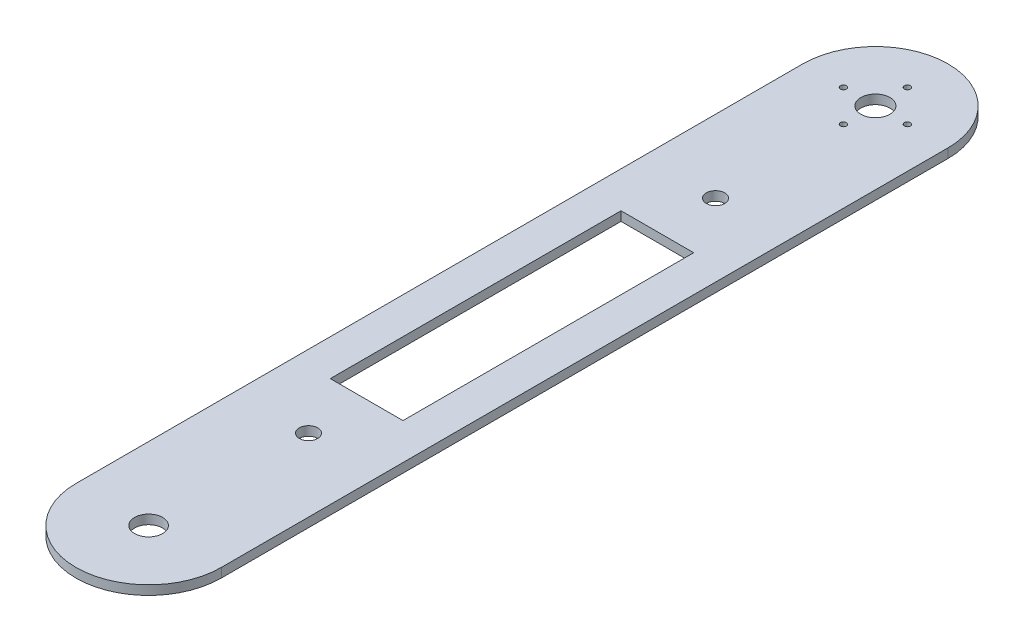
from build123d import *

# Parameters (mm, degrees)
SKETCH1_W           = 50
SKETCH1_H           = 300
BOSS_EXTRUDE1_DEPTH = 3.175
CUT_EXTRUDE1_DEPTH  = 6.35
SKETCH3_R           = 5
SKETCH3_R_2         = 4.82
SKETCH3_R_3         = 1.025
CUT_EXTRUDE2_DEPTH  = 6.35
SKETCH4_R           = 3.175
SKETCH4_W           = 25
SKETCH4_H           = 100
CUT_EXTRUDE3_DEPTH  = 6.35


with BuildPart() as part:
    # Sketch1 → Boss-Extrude1 (new body)
    with BuildSketch(Plane(origin=(0, 0, 0), x_dir=(1, 0, 0), z_dir=(0, 1, 0))):
        with Locations((25, -150)):
            Rectangle(SKETCH1_W, SKETCH1_H)
    extrude(amount=BOSS_EXTRUDE1_DEPTH)

    # Sketch2 → Cut-Extrude1 (cut)
    with BuildSketch(Plane(origin=(0, 3.175, 0), x_dir=(1, 0, 0), z_dir=(0, 1, 0))):
        with BuildLine():
            Line((0, 0), (0, -25))
            ThreePointArc((0, -25), (7.32233047, -7.32233047), (25, 0))
            Line((25, 0), (0, 0))
        make_face()
        with BuildLine():
            ThreePointArc((25, 0), (42.67766953, -7.32233047), (50, -25))
            Line((50, -25), (50, 0))
            Line((50, 0), (25, 0))
        make_face()
        with BuildLine():
            ThreePointArc((25, -300), (7.32233047, -292.67766953), (0, -275))
            Line((0, -275), (0, -300))
            Line((0, -300), (25, -300))
        make_face()
        with BuildLine():
            Line((50, -300), (50, -275))
            ThreePointArc((50, -275), (42.67766953, -292.67766953), (25, -300))
            Line((25, -300), (50, -300))
        make_face()
    extrude(amount=-CUT_EXTRUDE1_DEPTH, mode=Mode.SUBTRACT)

    # Sketch3 → Cut-Extrude2 (cut)
    with BuildSketch(Plane(origin=(0, 3.175, 0), x_dir=(1, 0, 0), z_dir=(0, 1, 0))):
        with Locations((25, -25)):
            Circle(SKETCH3_R)
        with Locations((25, -275)):
            Circle(SKETCH3_R_2)
        with Locations((25, -14)):
            Circle(SKETCH3_R_3)
        with Locations((14, -25)):
            Circle(SKETCH3_R_3)
        with Locations((25, -36)):
            Circle(SKETCH3_R_3)
        with Locations((36, -25)):
            Circle(SKETCH3_R_3)
    extrude(amount=-CUT_EXTRUDE2_DEPTH, mode=Mode.SUBTRACT)

    # Sketch4 → Cut-Extrude3 (cut)
    with BuildSketch(Plane(origin=(0, 3.175, 0), x_dir=(1, 0, 0), z_dir=(0, 1, 0))):
        with Locations((25, -80)):
            Circle(SKETCH4_R)
        with Locations((25, -220)):
            Circle(SKETCH4_R)
        with Locations((25, -150)):
            Rectangle(SKETCH4_W, SKETCH4_H)
    extrude(amount=-CUT_EXTRUDE3_DEPTH, mode=Mode.SUBTRACT)


solid = part.part
